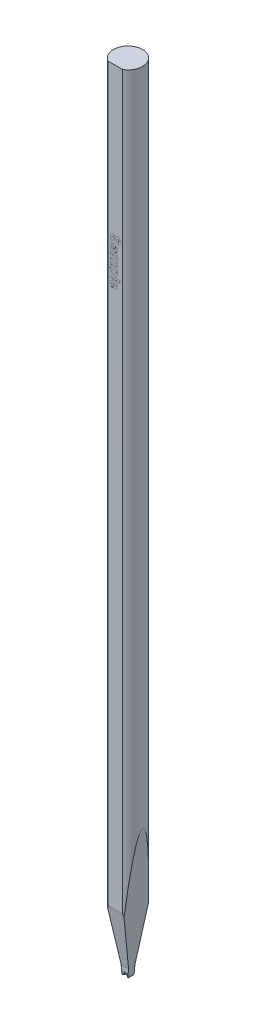
from build123d import *

# Parameters (mm, degrees)
SKETCH_TL_CUTTING_R       = 1.4986
TL_CUTTING_DEPTH          = 81.28
SKETCH_TDF_GRINDING_W     = 3.0172
SKETCH_TDF_GRINDING_H     = 3.0172
TDF_GRINDING_DEPTH        = 82.307625743
SKETCH_ENGRAVING_W        = 1
SKETCH_ENGRAVING_H        = 0.192307692
ENGRAVING_DEPTH           = 0.005
VW_VR_GRINDING_DEPTH      = 1.5086
VW_VR_GRINDING_DEPTH_BACK = 1.5086
ISA_GRINDING_DEPTH        = 1.5086
ISA_GRINDING_DEPTH_BACK   = 1.5086
PRE_FRX_BRX_DEPTH         = 1.5086
PRE_FRX_BRX_DEPTH_BACK    = 1.5086
SKETCH_PRE_FRX_BRX_W      = 1.18348
SKETCH_PRE_FRX_BRX_H      = 0.889
FR_EDM_R                  = 0.22606
BR_EDM_R                  = 0.22606
FA_BA_GRINDING_DEPTH      = 1.5086
FA_BA_GRINDING_DEPTH_BACK = 1.5086


with BuildPart() as part:
    # sketch_TL_cutting → TL_cutting (new body)
    with BuildSketch(Plane(origin=(0, 0, 0), x_dir=(1, 0, 0), z_dir=(0, 1, 0))):
        Circle(SKETCH_TL_CUTTING_R)
    extrude(amount=TL_CUTTING_DEPTH)

    # sketch_TDF_grinding → TDF_grinding (cut, through all)
    with BuildSketch(Plane(origin=(0, 0, 0), x_dir=(1, 0, 0), z_dir=(0, 1, 0))):
        with Locations((0, -2.804)):
            Rectangle(SKETCH_TDF_GRINDING_W, SKETCH_TDF_GRINDING_H)
    extrude(amount=TDF_GRINDING_DEPTH, mode=Mode.SUBTRACT)

    # sketch_engraving → engraving (cut)
    # profile 1 of 6: a face of its own
    with BuildSketch(Plane.XY.offset(1.2954)):
        with BuildLine():
            Line((-0.166666667, 66.228717949), (-0.153846154, 66.036410256))
            add(Edge.make_bspline(
                [(-0.153846154, 66.036410256), (-0.161891279, 66.034877607), (-0.177518424, 66.031900534), (-0.199795017, 66.025296625), (-0.220541784, 66.017990456), (-0.239662803, 66.009377579), (-0.25710555, 65.999512511), (-0.273156714, 65.988722233), (-0.28732832, 65.976479477), (-0.299925293, 65.963147792), (-0.310783278, 65.948574614), (-0.320246275, 65.932874014), (-0.328256178, 65.915952746), (-0.334922245, 65.897875434), (-0.339885492, 65.878462022), (-0.343420115, 65.857894378), (-0.345682646, 65.836139377), (-0.345994208, 65.821271711), (-0.346153846, 65.813653846)],
                knots=[0, 0, 0, 0, 1.20477517, 2.340199137, 3.415898527, 4.440826703, 5.422227366, 6.362763262, 7.28278988, 8.172822029, 9.057410505, 9.952475558, 10.866920142, 11.809098, 12.784128911, 13.811833846, 14.878831738, 16, 16, 16, 16], degree=3))
            add(Edge.make_bspline(
                [(-0.346153846, 65.813653846), (-0.346066367, 65.805635548), (-0.345896216, 65.790039545), (-0.343785338, 65.767439212), (-0.340761278, 65.746306874), (-0.335974263, 65.726829137), (-0.330620744, 65.708642273), (-0.323296559, 65.692197968), (-0.314849171, 65.677230114), (-0.305263574, 65.663777272), (-0.294632459, 65.652036964), (-0.28353392, 65.641765956), (-0.272207737, 65.632820587), (-0.260151301, 65.625779949), (-0.247852227, 65.620082055), (-0.234943611, 65.616316145), (-0.221721863, 65.613772051), (-0.212685699, 65.613480317), (-0.208133013, 65.613333333)],
                knots=[0, 0, 0, 0, 1.417779877, 2.757654889, 4.012140507, 5.189587551, 6.302846416, 7.360586765, 8.365575446, 9.33904572, 10.275781718, 11.161696098, 12.012180333, 12.822428111, 13.625933072, 14.403138519, 15.195454004, 16, 16, 16, 16], degree=3))
            add(Edge.make_bspline(
                [(-0.208133013, 65.613333333), (-0.202439146, 65.613627611), (-0.191320796, 65.614202244), (-0.175220679, 65.617972543), (-0.160658688, 65.624777047), (-0.147071392, 65.634013587), (-0.134926522, 65.646977985), (-0.123459543, 65.663382139), (-0.11316916, 65.683841853), (-0.107424402, 65.699010458), (-0.104366987, 65.707083333)],
                knots=[0, 0, 0, 0, 0.906150226, 1.7694295, 2.610923838, 3.450874087, 4.367551936, 5.419872502, 6.626831617, 8, 8, 8, 8], degree=3))
            add(Edge.make_bspline(
                [(-0.104366987, 65.707083333), (-0.103205903, 65.710547521), (-0.100607587, 65.718299809), (-0.096897182, 65.731525769), (-0.092218385, 65.747511172), (-0.087052561, 65.766404594), (-0.081545375, 65.7881675), (-0.074955523, 65.812593148), (-0.068334023, 65.840052448), (-0.063456004, 65.85926551), (-0.060897436, 65.869342949)],
                knots=[0, 0, 0, 0, 0.521824192, 1.167757792, 1.961731518, 2.901193269, 3.965386864, 5.168422915, 6.514810244, 8, 8, 8, 8], degree=3))
            add(Edge.make_bspline(
                [(-0.060897436, 65.869342949), (-0.0576208, 65.882466465), (-0.051299067, 65.907786143), (-0.040053153, 65.943897802), (-0.028879714, 65.9771573), (-0.016755933, 66.007244403), (-0.004503472, 66.034490983), (0.008737874, 66.058456319), (0.022280434, 66.079640515), (0.032402475, 66.091985038), (0.037259615, 66.097908654)],
                knots=[0, 0, 0, 0, 1.293880989, 2.496331788, 3.617634808, 4.64976062, 5.598842568, 6.473791081, 7.267636666, 8, 8, 8, 8], degree=3))
            add(Edge.make_bspline(
                [(0.037259615, 66.097908654), (0.044137694, 66.105254708), (0.057622804, 66.119657326), (0.079781426, 66.138616137), (0.103188466, 66.154546701), (0.127671148, 66.1676593), (0.153370416, 66.177755752), (0.180114252, 66.184911988), (0.207972454, 66.189543764), (0.22694455, 66.190016405), (0.236578526, 66.19025641)],
                knots=[0, 0, 0, 0, 1.064429417, 2.086912298, 3.078678339, 4.055528992, 5.020032834, 5.993708893, 6.981211098, 8, 8, 8, 8], degree=3))
            add(Edge.make_bspline(
                [(0.236578526, 66.19025641), (0.249044725, 66.189788947), (0.273773943, 66.188861639), (0.310123415, 66.180359285), (0.34519423, 66.167110895), (0.373053378, 66.151758506), (0.394102454, 66.136979981), (0.409316468, 66.124753329), (0.423234984, 66.111063515), (0.436363342, 66.096402084), (0.448421192, 66.080522948), (0.459337354, 66.063406575), (0.469762031, 66.04537482), (0.481724432, 66.019062443), (0.494501972, 65.983531575), (0.505216674, 65.937296526), (0.511620444, 65.886950752), (0.512410831, 65.852001491), (0.512820513, 65.833886218)],
                knots=[0, 0, 0, 0, 1.180224575, 2.341213254, 3.519178081, 4.726056898, 5.344182394, 5.956118988, 6.573855441, 7.192564044, 7.82049682, 8.461345463, 9.116141012, 9.79299132, 11.198532007, 12.687823846, 14.283197644, 16, 16, 16, 16], degree=3))
            add(Edge.make_bspline(
                [(0.512820513, 65.833886218), (0.512622915, 65.819053184), (0.512238592, 65.79020325), (0.508327094, 65.748385277), (0.502300976, 65.709376936), (0.493471523, 65.67324209), (0.482080613, 65.639912702), (0.468307987, 65.609323819), (0.4520288, 65.58155582), (0.433078398, 65.556903847), (0.412189308, 65.534940609), (0.389371716, 65.515781372), (0.364914548, 65.49935264), (0.338835479, 65.485548448), (0.311000478, 65.47470805), (0.281444264, 65.466746206), (0.250236407, 65.461480173), (0.228852471, 65.460160226), (0.217948718, 65.459487179)],
                knots=[0, 0, 0, 0, 1.325136797, 2.577362738, 3.74962816, 4.849499017, 5.896771726, 6.892816139, 7.842473141, 8.766187929, 9.665133525, 10.546015357, 11.42313021, 12.293255665, 13.177485873, 14.086514152, 15.024305989, 16, 16, 16, 16], degree=3))
            Line((0.217948718, 65.459487179), (0.205128205, 65.651794872))
            add(Edge.make_bspline(
                [(0.205128205, 65.651794872), (0.211158714, 65.652903797), (0.22291155, 65.655064976), (0.239739753, 65.659772083), (0.255319488, 65.66505285), (0.269550394, 65.67131916), (0.282452554, 65.678537492), (0.29405422, 65.686741672), (0.304442868, 65.695777543), (0.313348905, 65.706026012), (0.321255295, 65.717250185), (0.327770309, 65.729876673), (0.333732615, 65.7435148), (0.338229411, 65.758675772), (0.341791978, 65.775084625), (0.344434282, 65.792746154), (0.34572413, 65.811698367), (0.346007328, 65.824736733), (0.346153846, 65.831482372)],
                knots=[0, 0, 0, 0, 1.150775252, 2.242741279, 3.277646382, 4.23752694, 5.158201782, 6.048759188, 6.901533576, 7.736611693, 8.592238639, 9.472855288, 10.399741491, 11.383322377, 12.435924598, 13.551250831, 14.733094547, 16, 16, 16, 16], degree=3))
            add(Edge.make_bspline(
                [(0.346153846, 65.831482372), (0.346024502, 65.838495999), (0.345772856, 65.852141324), (0.344228543, 65.8720262), (0.34137789, 65.890679706), (0.337667048, 65.908193454), (0.332618703, 65.924544049), (0.326463073, 65.939696989), (0.319216002, 65.953721597), (0.313514257, 65.962273191), (0.310697115, 65.966498397)],
                knots=[0, 0, 0, 0, 1.186678824, 2.308736671, 3.37120409, 4.377216403, 5.334874112, 6.262130804, 7.141346615, 8, 8, 8, 8], degree=3))
            add(Edge.make_bspline(
                [(0.310697115, 65.966498397), (0.30684882, 65.971333791), (0.299395868, 65.980698448), (0.284596838, 65.9907768), (0.267881777, 65.996843991), (0.256061421, 65.997574247), (0.25, 65.997948718)],
                knots=[0, 0, 0, 0, 1.037857257, 2.010007357, 2.979541333, 4, 4, 4, 4], degree=3))
            add(Edge.make_bspline(
                [(0.25, 65.997948718), (0.244335199, 65.997642469), (0.233176443, 65.997039206), (0.217325189, 65.990954527), (0.202637862, 65.98159712), (0.194659513, 65.972854158), (0.190504808, 65.968301282)],
                knots=[0, 0, 0, 0, 0.98538058, 1.941042925, 2.927803204, 4, 4, 4, 4], degree=3))
            add(Edge.make_bspline(
                [(0.190504808, 65.968301282), (0.187808196, 65.964687988), (0.18178239, 65.956613781), (0.17412302, 65.941823434), (0.165827461, 65.923971096), (0.157717635, 65.902649778), (0.149622864, 65.878001181), (0.141170987, 65.850023806), (0.132605635, 65.818700446), (0.124310512, 65.784829517), (0.116156882, 65.750440984), (0.107242663, 65.717624955), (0.098551989, 65.687110767), (0.089442753, 65.659039906), (0.080574939, 65.633267671), (0.071467056, 65.609919256), (0.062596997, 65.58883434), (0.050400038, 65.564246991), (0.033878763, 65.536379703), (0.009862335, 65.507171642), (-0.017133698, 65.48134084), (-0.042589095, 65.463342623), (-0.064481415, 65.450978789), (-0.081932142, 65.443017785), (-0.100320809, 65.436130892), (-0.119667735, 65.43052498), (-0.140000145, 65.426462043), (-0.161162698, 65.423099726), (-0.183331155, 65.421381856), (-0.198448465, 65.421145657), (-0.206129808, 65.421025641)],
                knots=[0, 0, 0, 0, 0.511875881, 1.143829537, 1.88775736, 2.750598373, 3.734912702, 4.837306479, 6.073130119, 7.42648979, 8.801963576, 10.091065733, 11.292408984, 12.408830014, 13.446061236, 14.39066453, 15.257936293, 16.045629259, 17.510392066, 18.929669597, 20.331293837, 21.746891395, 22.460690638, 23.187651344, 23.925159671, 24.69163991, 25.474819891, 26.281170188, 27.126635539, 28, 28, 28, 28], degree=3))
            add(Edge.make_bspline(
                [(-0.206129808, 65.421025641), (-0.213213723, 65.421190667), (-0.227281693, 65.421518393), (-0.248162112, 65.42380863), (-0.268671734, 65.427350423), (-0.288836268, 65.432593495), (-0.308616053, 65.439548961), (-0.328296541, 65.447380279), (-0.347448635, 65.45717284), (-0.366087841, 65.468318337), (-0.384201522, 65.48061148), (-0.400907086, 65.494545053), (-0.416780552, 65.509286381), (-0.430830184, 65.525791492), (-0.444499814, 65.542874729), (-0.456413626, 65.561651015), (-0.467267368, 65.581519569), (-0.476944445, 65.602661493), (-0.485241283, 65.625146826), (-0.492760445, 65.648840495), (-0.498861937, 65.67396603), (-0.504102567, 65.700352968), (-0.508085093, 65.728103742), (-0.510866581, 65.757181988), (-0.512434986, 65.787594789), (-0.512690407, 65.80831022), (-0.512820513, 65.818862179)],
                knots=[0, 0, 0, 0, 0.900523777, 1.788352984, 2.667658312, 3.544829998, 4.433470602, 5.332071549, 6.235671317, 7.16456001, 8.092361829, 9.015217829, 9.927983376, 10.842405559, 11.767913001, 12.707486241, 13.664840466, 14.644960138, 15.660436429, 16.710285012, 17.80361473, 18.945755434, 20.129541241, 21.366238063, 22.658422763, 24, 24, 24, 24], degree=3))
            add(Edge.make_bspline(
                [(-0.512820513, 65.818862179), (-0.512571769, 65.834097584), (-0.512087459, 65.863761277), (-0.507752501, 65.906857296), (-0.501117535, 65.947278506), (-0.491487967, 65.98495912), (-0.47912575, 66.019945132), (-0.463898318, 66.052220803), (-0.445714308, 66.081629249), (-0.4250161, 66.108537493), (-0.401421388, 66.132576838), (-0.37543806, 66.154222472), (-0.346733609, 66.173055309), (-0.315676999, 66.189585327), (-0.28185988, 66.203074186), (-0.245840091, 66.214602175), (-0.207125792, 66.223178959), (-0.180386288, 66.226839687), (-0.166666667, 66.228717949)],
                knots=[0, 0, 0, 0, 1.217919187, 2.371317543, 3.459749122, 4.490553404, 5.476795534, 6.422548752, 7.338285933, 8.236452553, 9.131296239, 10.026155855, 10.935394819, 11.871650654, 12.834387429, 13.842485342, 14.893012909, 16, 16, 16, 16], degree=3))
        make_face()
    # profile 2 of 6: a face of its own
    with BuildSketch(Plane.XY.offset(1.2954)):
        with BuildLine():
            Line((0.012820513, 65.126153846), (0.038461538, 65.292820513))
            add(Edge.make_bspline(
                [(0.038461538, 65.292820513), (0.046909054, 65.290322773), (0.063444893, 65.285433497), (0.0871409, 65.276461597), (0.109047839, 65.265955594), (0.129427422, 65.254368962), (0.148056862, 65.241344679), (0.164984622, 65.227090911), (0.180152765, 65.211527103), (0.19367872, 65.194578871), (0.205694353, 65.17592015), (0.215881219, 65.155127383), (0.224458705, 65.132231732), (0.231351998, 65.107265345), (0.237115058, 65.080270108), (0.240643117, 65.051039394), (0.243189827, 65.019761739), (0.243453822, 64.99822163), (0.243589744, 64.98713141)],
                knots=[0, 0, 0, 0, 1.047140172, 2.049755565, 3.008539736, 3.933190086, 4.833981818, 5.707167246, 6.560530269, 7.413560864, 8.281243119, 9.193714071, 10.161006392, 11.183910126, 12.270717139, 13.439589873, 14.681737877, 16, 16, 16, 16], degree=3))
            add(Edge.make_bspline(
                [(0.243589744, 64.98713141), (0.243534228, 64.977046723), (0.243426815, 64.957534437), (0.242000124, 64.92926808), (0.239698922, 64.903054289), (0.236188636, 64.878814358), (0.232169239, 64.856495802), (0.226945807, 64.836146141), (0.220823169, 64.817813075), (0.211299506, 64.796630462), (0.197913915, 64.773367886), (0.179756247, 64.74906565), (0.159013578, 64.729617094), (0.139821698, 64.716528755), (0.122335675, 64.708827836), (0.106814059, 64.703855466), (0.088956248, 64.699474221), (0.068502887, 64.69624198), (0.045803313, 64.693340808), (0.020516352, 64.691733811), (-0.007131366, 64.690443155), (-0.026440401, 64.690320201), (-0.036458333, 64.69025641)],
                knots=[0, 0, 0, 0, 1.253089278, 2.424530831, 3.516103812, 4.521791402, 5.467348922, 6.332758186, 7.130477226, 7.865998692, 9.215316109, 10.458392318, 11.620687606, 12.7345829, 13.32519123, 13.989073223, 14.757870489, 15.607744835, 16.560809343, 17.600728964, 18.755207866, 20, 20, 20, 20], degree=3))
            Line((-0.036458333, 64.69025641), (-0.261017628, 64.69025641))
            add(Edge.make_bspline(
                [(-0.261017628, 64.69025641), (-0.26876291, 64.690191106), (-0.283720285, 64.690064994), (-0.305369916, 64.689858726), (-0.325384127, 64.68860567), (-0.343848542, 64.687883727), (-0.360723997, 64.686104895), (-0.3760468, 64.684451041), (-0.389817284, 64.68223103), (-0.406271816, 64.678727434), (-0.426174196, 64.672982854), (-0.450246687, 64.664096636), (-0.475006195, 64.652613939), (-0.491503263, 64.643611185), (-0.5, 64.638974359)],
                knots=[0, 0, 0, 0, 1.124133555, 2.170881208, 3.141136401, 4.03397314, 4.851653906, 5.602897914, 6.270414243, 6.874806075, 8.043499627, 9.272964875, 10.595453442, 12, 12, 12, 12], degree=3))
            Line((-0.5, 64.638974359), (-0.5, 64.831282051))
            add(Edge.make_bspline(
                [(-0.5, 64.831282051), (-0.496139139, 64.832654663), (-0.487679201, 64.835662336), (-0.473498086, 64.839724209), (-0.456975369, 64.844592099), (-0.445053008, 64.847801538), (-0.438701923, 64.849511218)],
                knots=[0, 0, 0, 0, 0.768508203, 1.683958961, 2.766236402, 4, 4, 4, 4], degree=3))
            add(Edge.make_bspline(
                [(-0.438701923, 64.849511218), (-0.435886901, 64.850208108), (-0.430774033, 64.851473855), (-0.423993811, 64.853691297), (-0.418613075, 64.854860943), (-0.415659063, 64.855901037), (-0.414463141, 64.856322115)],
                knots=[0, 0, 0, 0, 1.38134116, 2.508902287, 3.396334264, 4, 4, 4, 4], degree=3))
            add(Edge.make_bspline(
                [(-0.414463141, 64.856322115), (-0.422306637, 64.864457559), (-0.437655041, 64.880377254), (-0.457532204, 64.906341122), (-0.474646093, 64.932866544), (-0.488605327, 64.960386904), (-0.499566193, 64.988746676), (-0.507080988, 65.018140575), (-0.511891829, 65.048405165), (-0.512508639, 65.068910725), (-0.512820513, 65.079278846)],
                knots=[0, 0, 0, 0, 1.082278699, 2.117837564, 3.127951196, 4.103896207, 5.070141411, 6.035602179, 7.006751569, 8, 8, 8, 8], degree=3))
            add(Edge.make_bspline(
                [(-0.512820513, 65.079278846), (-0.512611735, 65.08829889), (-0.51220396, 65.105916381), (-0.50951013, 65.131624012), (-0.504401451, 65.155789166), (-0.497605711, 65.178521026), (-0.489067093, 65.199880039), (-0.478321262, 65.219662593), (-0.465716244, 65.23801315), (-0.450989615, 65.25454154), (-0.435073542, 65.269551608), (-0.417958735, 65.282644355), (-0.399800554, 65.293800397), (-0.380541476, 65.302748564), (-0.360298141, 65.309888733), (-0.339064305, 65.314796291), (-0.316799924, 65.317929124), (-0.301626775, 65.318281435), (-0.293870192, 65.318461538)],
                knots=[0, 0, 0, 0, 1.18658458, 2.31757657, 3.394226474, 4.430715881, 5.435456892, 6.414057866, 7.386212409, 8.35709637, 9.320281587, 10.260156395, 11.186596348, 12.117853754, 13.048448167, 14.005042754, 14.980168739, 16, 16, 16, 16], degree=3))
            add(Edge.make_bspline(
                [(-0.293870192, 65.318461538), (-0.283700577, 65.31810511), (-0.263757923, 65.317406153), (-0.234652538, 65.312208551), (-0.207362153, 65.303020466), (-0.181862262, 65.290629198), (-0.158596875, 65.27506418), (-0.138063167, 65.256372743), (-0.120502285, 65.234769213), (-0.105770222, 65.2096943), (-0.093232389, 65.180477431), (-0.081107706, 65.146412551), (-0.070353555, 65.106569614), (-0.064168165, 65.077973636), (-0.060897436, 65.062852564)],
                knots=[0, 0, 0, 0, 0.956565251, 1.875828012, 2.769799286, 3.657635185, 4.535794535, 5.394066738, 6.260416921, 7.14495727, 8.120882861, 9.247498621, 10.544523601, 12, 12, 12, 12], degree=3))
            add(Edge.make_bspline(
                [(-0.060897436, 65.062852564), (-0.058777918, 65.052432311), (-0.054697922, 65.032373691), (-0.048550502, 65.003563846), (-0.042415315, 64.977294761), (-0.036019644, 64.953603672), (-0.030418943, 64.932204546), (-0.024623629, 64.913353208), (-0.018838679, 64.897055523), (-0.014727786, 64.887156714), (-0.012820513, 64.882564103)],
                knots=[0, 0, 0, 0, 1.365617471, 2.628765604, 3.783168753, 4.829402825, 5.780074121, 6.623651276, 7.361434847, 8, 8, 8, 8], degree=3))
            Line((-0.012820513, 64.882564103), (0.005408654, 64.882564103))
            add(Edge.make_bspline(
                [(0.005408654, 64.882564103), (0.013579622, 64.88282195), (0.028753575, 64.883300787), (0.049815104, 64.888012783), (0.067054204, 64.896267499), (0.078735074, 64.905966174), (0.085649046, 64.915766975), (0.090345699, 64.924467914), (0.093950934, 64.934721013), (0.097287101, 64.946260364), (0.0995171, 64.959301833), (0.101382359, 64.973729797), (0.102294697, 64.98959078), (0.102471846, 65.000618931), (0.102564103, 65.006362179)],
                knots=[0, 0, 0, 0, 1.600017626, 2.971323677, 4.194571328, 5.31736933, 5.898517236, 6.536691297, 7.248930295, 8.023708211, 8.888724419, 9.83830628, 10.874231527, 12, 12, 12, 12], degree=3))
            add(Edge.make_bspline(
                [(0.102564103, 65.006362179), (0.102372886, 65.013991824), (0.102007879, 65.02855582), (0.098228604, 65.049020653), (0.092028517, 65.066964405), (0.083011553, 65.082505158), (0.070677976, 65.095940445), (0.054784235, 65.107641921), (0.03524962, 65.118007335), (0.020578142, 65.123336186), (0.012820513, 65.126153846)],
                knots=[0, 0, 0, 0, 1.120624541, 2.139125895, 3.045753857, 3.899333821, 4.761059621, 5.707367731, 6.787757473, 8, 8, 8, 8], degree=3))
        make_face()
        with BuildLine():
            add(Edge.make_bspline(
                [(-0.153846154, 64.882564103), (-0.155885143, 64.889164138), (-0.16047749, 64.904029178), (-0.167188394, 64.928940204), (-0.174366647, 64.958953522), (-0.180456821, 64.986656294), (-0.185514697, 65.009876191), (-0.189475935, 65.026252939), (-0.193539681, 65.040999709), (-0.197441348, 65.054126554), (-0.201486639, 65.065681533), (-0.205463261, 65.075551125), (-0.209129994, 65.08400598), (-0.212150439, 65.088724204), (-0.213541667, 65.090897436)],
                knots=[0, 0, 0, 0, 1.144251806, 2.577159925, 4.272729571, 6.25595871, 7.275767821, 8.209390473, 9.046628288, 9.809462825, 10.477647263, 11.07332096, 11.573168194, 12, 12, 12, 12], degree=3))
            add(Edge.make_bspline(
                [(-0.213541667, 65.090897436), (-0.217777869, 65.096276024), (-0.225907663, 65.106598198), (-0.241618317, 65.117850564), (-0.259035906, 65.124990897), (-0.271365501, 65.12576145), (-0.277644231, 65.126153846)],
                knots=[0, 0, 0, 0, 1.075028234, 2.063111864, 3.013658082, 4, 4, 4, 4], degree=3))
            add(Edge.make_bspline(
                [(-0.277644231, 65.126153846), (-0.283891387, 65.12580773), (-0.296145658, 65.125128798), (-0.31380435, 65.1197217), (-0.329979349, 65.110627478), (-0.344370894, 65.098247385), (-0.356745621, 65.083373769), (-0.365439774, 65.065879161), (-0.370822638, 65.046475583), (-0.371463572, 65.032840996), (-0.371794872, 65.025793269)],
                knots=[0, 0, 0, 0, 0.97671936, 1.915908908, 2.861187175, 3.862381481, 4.872972798, 5.868749731, 6.898355403, 8, 8, 8, 8], degree=3))
            add(Edge.make_bspline(
                [(-0.371794872, 65.025793269), (-0.37143029, 65.017735914), (-0.370696317, 65.001514937), (-0.363990016, 64.977724736), (-0.354091612, 64.954236416), (-0.344349902, 64.939974458), (-0.339342949, 64.932644231)],
                knots=[0, 0, 0, 0, 0.962503947, 1.937702252, 2.940039444, 4, 4, 4, 4], degree=3))
            add(Edge.make_bspline(
                [(-0.339342949, 64.932644231), (-0.335175233, 64.927467353), (-0.32707178, 64.917401747), (-0.312263496, 64.905404959), (-0.296511013, 64.89550495), (-0.284890152, 64.891559389), (-0.279046474, 64.889575321)],
                knots=[0, 0, 0, 0, 1.055399509, 2.052054707, 3.020454315, 4, 4, 4, 4], degree=3))
            add(Edge.make_bspline(
                [(-0.279046474, 64.889575321), (-0.274254264, 64.888481826), (-0.263036327, 64.885922099), (-0.243287652, 64.884116149), (-0.218440013, 64.88265525), (-0.200124236, 64.882596334), (-0.190104167, 64.882564103)],
                knots=[0, 0, 0, 0, 0.659054705, 1.542760655, 2.655710416, 4, 4, 4, 4], degree=3))
            Line((-0.190104167, 64.882564103), (-0.153846154, 64.882564103))
        make_face(mode=Mode.SUBTRACT)
    # profile 3 of 6: a face of its own
    with BuildSketch(Plane.XY.offset(1.2954)):
        with BuildLine():
            Line((0.230769231, 64.510769231), (0.230769231, 64.318461538))
            Line((0.230769231, 64.318461538), (0.1328125, 64.318461538))
            add(Edge.make_bspline(
                [(0.1328125, 64.318461538), (0.141664699, 64.310897511), (0.158931351, 64.296143499), (0.181382685, 64.271462251), (0.200586186, 64.2459552), (0.21644089, 64.21937127), (0.228531159, 64.191472579), (0.237134296, 64.162485336), (0.242539521, 64.13243041), (0.243237377, 64.112020357), (0.243589744, 64.101714744)],
                knots=[0, 0, 0, 0, 1.107940857, 2.161093632, 3.169644562, 4.144639019, 5.101548547, 6.057210626, 7.019030711, 8, 8, 8, 8], degree=3))
            add(Edge.make_bspline(
                [(0.243589744, 64.101714744), (0.243215794, 64.090948495), (0.242486901, 64.069963206), (0.237632212, 64.039505651), (0.228624904, 64.01142895), (0.216596826, 63.985473491), (0.200997643, 63.961725385), (0.181697421, 63.940341944), (0.1589088, 63.921109403), (0.141647297, 63.910586276), (0.1328125, 63.905200321)],
                knots=[0, 0, 0, 0, 1.087442074, 2.119613481, 3.102840357, 4.056171906, 5.000733146, 5.960649063, 6.95621775, 8, 8, 8, 8], degree=3))
            add(Edge.make_bspline(
                [(0.1328125, 63.905200321), (0.141648331, 63.897280271), (0.15890459, 63.881812522), (0.18160607, 63.856450997), (0.200837622, 63.830127047), (0.216342266, 63.802724069), (0.228440547, 63.774425033), (0.237463475, 63.745274977), (0.242455792, 63.714933774), (0.243209151, 63.694413285), (0.243589744, 63.684046474)],
                knots=[0, 0, 0, 0, 1.113355786, 2.174368662, 3.188819075, 4.168565139, 5.12342631, 6.073356391, 7.026672896, 8, 8, 8, 8], degree=3))
            add(Edge.make_bspline(
                [(0.243589744, 63.684046474), (0.243253707, 63.671264411), (0.242603687, 63.64653916), (0.236233833, 63.610990396), (0.226092646, 63.578384669), (0.211825029, 63.548909889), (0.193628332, 63.522613111), (0.171312748, 63.500075383), (0.145297956, 63.480737741), (0.125650654, 63.471322182), (0.115584936, 63.466498397)],
                knots=[0, 0, 0, 0, 1.140905914, 2.206935121, 3.214358517, 4.182792527, 5.121068659, 6.057503675, 7.004819049, 8, 8, 8, 8], degree=3))
            add(Edge.make_bspline(
                [(0.115584936, 63.466498397), (0.1114006, 63.464896604), (0.102614163, 63.461533095), (0.088193677, 63.457579062), (0.07205936, 63.454256297), (0.05407705, 63.451438692), (0.034354022, 63.449322459), (0.012779717, 63.447648455), (-0.010546601, 63.44699832), (-0.026709385, 63.446779611), (-0.03505609, 63.446666667)],
                knots=[0, 0, 0, 0, 0.70348757, 1.477211565, 2.345356006, 3.290383569, 4.335215205, 5.460703428, 6.68866909, 8, 8, 8, 8], degree=3))
            Line((-0.03505609, 63.446666667), (-0.5, 63.446666667))
            Line((-0.5, 63.446666667), (-0.5, 63.638974359))
            Line((-0.5, 63.638974359), (-0.080128205, 63.638974359))
            add(Edge.make_bspline(
                [(-0.080128205, 63.638974359), (-0.07144761, 63.639086396), (-0.054817384, 63.639301037), (-0.031090468, 63.639945192), (-0.009777274, 63.641583104), (0.009076857, 63.643724828), (0.025551617, 63.646457511), (0.039613136, 63.649833558), (0.051411557, 63.653627728), (0.058064109, 63.657184264), (0.061097756, 63.65880609)],
                knots=[0, 0, 0, 0, 1.448583407, 2.775186282, 3.959557885, 5.014017743, 5.940851432, 6.743435621, 7.42699079, 8, 8, 8, 8], degree=3))
            add(Edge.make_bspline(
                [(0.061097756, 63.65880609), (0.0644449, 63.661046703), (0.071015994, 63.665445463), (0.079428524, 63.673581971), (0.086594396, 63.682526034), (0.092366124, 63.692410543), (0.097066603, 63.703069139), (0.100204228, 63.714687303), (0.10230955, 63.727171978), (0.102477414, 63.735853298), (0.102564103, 63.740336538)],
                knots=[0, 0, 0, 0, 1.007330723, 1.977586358, 2.91811154, 3.870610884, 4.837109745, 5.827490497, 6.87806446, 8, 8, 8, 8], degree=3))
            add(Edge.make_bspline(
                [(0.102564103, 63.740336538), (0.102240034, 63.746972111), (0.101593875, 63.760202775), (0.09685111, 63.779660701), (0.088810593, 63.798387428), (0.077873982, 63.816238407), (0.064089543, 63.832877276), (0.046951113, 63.846953185), (0.027058253, 63.858722569), (0.008201325, 63.866104518), (-0.008714124, 63.87081352), (-0.023370098, 63.873967347), (-0.039736185, 63.876768488), (-0.057919723, 63.878964673), (-0.07777632, 63.880456881), (-0.09941442, 63.881666157), (-0.122723067, 63.882512129), (-0.138888099, 63.882546404), (-0.147235577, 63.882564103)],
                knots=[0, 0, 0, 0, 0.980909897, 1.955835539, 2.942693402, 3.98436442, 5.042755257, 6.12263035, 7.247279534, 8.448501813, 9.105087946, 9.843148781, 10.66469806, 11.560151265, 12.550905382, 13.609296218, 14.765461946, 16, 16, 16, 16], degree=3))
            Line((-0.147235577, 63.882564103), (-0.5, 63.882564103))
            Line((-0.5, 63.882564103), (-0.5, 64.074871795))
            Line((-0.5, 64.074871795), (-0.097355769, 64.074871795))
            add(Edge.make_bspline(
                [(-0.097355769, 64.074871795), (-0.088808683, 64.074926135), (-0.072514885, 64.075029726), (-0.049272866, 64.075370876), (-0.028431625, 64.076137425), (-0.010001412, 64.077354799), (0.006094573, 64.078757797), (0.019817647, 64.080232173), (0.031211059, 64.082185261), (0.042972639, 64.085301362), (0.055281064, 64.090213036), (0.068015353, 64.097443829), (0.078952496, 64.105913541), (0.087734398, 64.116130961), (0.094431133, 64.128066292), (0.099289836, 64.141728729), (0.101996826, 64.157298124), (0.102369061, 64.168277531), (0.102564103, 64.174030449)],
                knots=[0, 0, 0, 0, 1.59941463, 3.049055322, 4.349500855, 5.501487129, 6.504910079, 7.372843676, 8.083634967, 8.665560774, 9.647038445, 10.55368294, 11.398647399, 12.222657519, 13.056461931, 13.945719492, 14.92361148, 16, 16, 16, 16], degree=3))
            add(Edge.make_bspline(
                [(0.102564103, 64.174030449), (0.102234348, 64.181196829), (0.101586917, 64.195267082), (0.097099356, 64.215860655), (0.089385598, 64.235235661), (0.078745529, 64.253299036), (0.065308531, 64.269702826), (0.048811546, 64.28360159), (0.02977557, 64.295138856), (0.011740073, 64.30242889), (-0.004479026, 64.307158642), (-0.018770373, 64.310049471), (-0.034874654, 64.312649694), (-0.052844538, 64.314858981), (-0.072766981, 64.316377908), (-0.094540599, 64.31755338), (-0.118182385, 64.31841378), (-0.134547779, 64.318445237), (-0.143028846, 64.318461538)],
                knots=[0, 0, 0, 0, 1.061105177, 2.08334182, 3.104381884, 4.137278018, 5.176827868, 6.229094397, 7.316239487, 8.460364206, 9.09881589, 9.816452537, 10.617971519, 11.514628853, 12.496857794, 13.576419947, 14.74402393, 16, 16, 16, 16], degree=3))
            Line((-0.143028846, 64.318461538), (-0.5, 64.318461538))
            Line((-0.5, 64.318461538), (-0.5, 64.510769231))
            Line((-0.5, 64.510769231), (0.230769231, 64.510769231))
        make_face()
    # profile 4 of 6: a face of its own
    with BuildSketch(Plane.XY.offset(1.2954)):
        with BuildLine():
            Line((0.230769231, 63.254358974), (0.230769231, 63.062051282))
            Line((0.230769231, 63.062051282), (0.125400641, 63.062051282))
            add(Edge.make_bspline(
                [(0.125400641, 63.062051282), (0.134110558, 63.056328192), (0.151482958, 63.04491318), (0.174623276, 63.02385835), (0.194727471, 62.999718206), (0.21216262, 62.973179417), (0.226252501, 62.944345376), (0.236247247, 62.913671975), (0.242498657, 62.881481858), (0.243222023, 62.859489189), (0.243589744, 62.848309295)],
                knots=[0, 0, 0, 0, 0.978547196, 1.95176541, 2.927409496, 3.924956672, 4.929940552, 5.934297003, 6.949907262, 8, 8, 8, 8], degree=3))
            add(Edge.make_bspline(
                [(0.243589744, 62.848309295), (0.243275199, 62.838541821), (0.242653327, 62.819231017), (0.237904657, 62.790874643), (0.230300531, 62.763557527), (0.219424348, 62.737376502), (0.205256392, 62.712439427), (0.188112758, 62.688677123), (0.167850875, 62.666116128), (0.144791975, 62.644820256), (0.118886648, 62.625323008), (0.090438984, 62.608285417), (0.059420431, 62.594050634), (0.02614289, 62.582152555), (-0.00973483, 62.573328479), (-0.047865347, 62.566627494), (-0.088468702, 62.562921584), (-0.116312431, 62.562346541), (-0.130608974, 62.562051282)],
                knots=[0, 0, 0, 0, 0.889183518, 1.757962001, 2.610823862, 3.466866804, 4.332788647, 5.217155532, 6.130223362, 7.089913047, 8.071415563, 9.077827182, 10.103546864, 11.174887114, 12.291391641, 13.464112916, 14.69793237, 16, 16, 16, 16], degree=3))
            add(Edge.make_bspline(
                [(-0.130608974, 62.562051282), (-0.145309675, 62.562315908), (-0.173899782, 62.562830556), (-0.215458383, 62.566940588), (-0.254585771, 62.573314968), (-0.291083626, 62.583120651), (-0.325347568, 62.594933416), (-0.356921697, 62.609865855), (-0.386073852, 62.627339567), (-0.412336985, 62.6475977), (-0.435948519, 62.669531194), (-0.456547424, 62.692845565), (-0.473866574, 62.71737144), (-0.488041441, 62.743039276), (-0.499108447, 62.769855372), (-0.507216556, 62.797768366), (-0.511869709, 62.826919211), (-0.512500462, 62.846690556), (-0.512820513, 62.856722756)],
                knots=[0, 0, 0, 0, 1.306276956, 2.54046374, 3.708317787, 4.825351227, 5.895229917, 6.925275359, 7.923721025, 8.910100439, 9.867470588, 10.784172372, 11.670002506, 12.530604141, 13.384735846, 14.243124713, 15.108541968, 16, 16, 16, 16], degree=3))
            add(Edge.make_bspline(
                [(-0.512820513, 62.856722756), (-0.512609167, 62.866228647), (-0.512194245, 62.88489093), (-0.507198627, 62.912096366), (-0.500287281, 62.938126612), (-0.489449809, 62.96297979), (-0.475076841, 62.987355706), (-0.456848814, 63.012131713), (-0.434276455, 63.037369377), (-0.417064851, 63.053569123), (-0.408052885, 63.062051282)],
                knots=[0, 0, 0, 0, 0.955822701, 1.876503125, 2.776905967, 3.662325514, 4.596312032, 5.620965962, 6.754341905, 8, 8, 8, 8], degree=3))
            Line((-0.408052885, 63.062051282), (-0.769230769, 63.062051282))
            Line((-0.769230769, 63.062051282), (-0.769230769, 63.254358974))
            Line((-0.769230769, 63.254358974), (0.230769231, 63.254358974))
        make_face()
        with BuildLine():
            add(Edge.make_bspline(
                [(-0.122195513, 63.062051282), (-0.132481435, 63.061869399), (-0.152405274, 63.061517092), (-0.181244648, 63.0596158), (-0.208037309, 63.056085347), (-0.232684253, 63.050774209), (-0.255441334, 63.044588635), (-0.275988928, 63.036469266), (-0.294539024, 63.027160628), (-0.310824186, 63.016236628), (-0.325130191, 63.004357295), (-0.337524496, 62.991785976), (-0.348144327, 62.978613898), (-0.356821345, 62.964788021), (-0.363446941, 62.950207774), (-0.368372821, 62.93504583), (-0.371163803, 62.919191699), (-0.371583715, 62.908415646), (-0.371794872, 62.902996795)],
                knots=[0, 0, 0, 0, 1.493314022, 2.892550594, 4.193549699, 5.412205958, 6.550654332, 7.612709232, 8.614154521, 9.557822924, 10.452682187, 11.309508678, 12.116407821, 12.904513946, 13.672267114, 14.435601522, 15.213325928, 16, 16, 16, 16], degree=3))
            add(Edge.make_bspline(
                [(-0.371794872, 62.902996795), (-0.371659076, 62.897777458), (-0.371390934, 62.88747138), (-0.368717534, 62.87238879), (-0.36428733, 62.857978562), (-0.35796517, 62.844320696), (-0.350180339, 62.83118585), (-0.340400371, 62.818874137), (-0.328879204, 62.80732573), (-0.315890023, 62.796060335), (-0.300495775, 62.786347266), (-0.283066961, 62.777655169), (-0.26342759, 62.770240806), (-0.241425455, 62.764598273), (-0.21727146, 62.759992165), (-0.190916328, 62.756647541), (-0.162291664, 62.754622487), (-0.142498204, 62.754449089), (-0.132211538, 62.754358974)],
                knots=[0, 0, 0, 0, 0.791436533, 1.562766886, 2.315979036, 3.073269983, 3.841398674, 4.627954771, 5.451998839, 6.314818792, 7.231140921, 8.205467689, 9.266952699, 10.409907015, 11.648037837, 12.996681567, 14.439174734, 16, 16, 16, 16], degree=3))
            add(Edge.make_bspline(
                [(-0.132211538, 62.754358974), (-0.122590159, 62.754424206), (-0.103987384, 62.754550329), (-0.077055352, 62.756934923), (-0.051997139, 62.760142066), (-0.028873936, 62.765056593), (-0.007518455, 62.770845012), (0.01172948, 62.77855908), (0.029199081, 62.787330952), (0.044606747, 62.797634518), (0.058319539, 62.808764437), (0.069887203, 62.820950097), (0.080128065, 62.833373302), (0.08840061, 62.846618471), (0.094621072, 62.860689896), (0.099305551, 62.875235213), (0.101912651, 62.890551976), (0.102344136, 62.900917634), (0.102564103, 62.906201923)],
                knots=[0, 0, 0, 0, 1.476459806, 2.854710082, 4.147877, 5.352136794, 6.481419541, 7.539804139, 8.530071065, 9.476830027, 10.379846701, 11.23529603, 12.051777807, 12.848258948, 13.623682229, 14.408266492, 15.188553102, 16, 16, 16, 16], degree=3))
            add(Edge.make_bspline(
                [(0.102564103, 62.906201923), (0.102455308, 62.911692144), (0.102241498, 62.922481924), (0.099201363, 62.938244161), (0.094853437, 62.953393305), (0.088686029, 62.967855544), (0.080452533, 62.981364223), (0.070807323, 62.994386207), (0.059117992, 63.00648559), (0.045859614, 63.017998235), (0.030812699, 63.028454665), (0.01390315, 63.037434633), (-0.00466452, 63.044978908), (-0.024767533, 63.051509579), (-0.046730612, 63.056208148), (-0.070369893, 63.059483429), (-0.095705859, 63.061854034), (-0.113175154, 63.061984114), (-0.122195513, 63.062051282)],
                knots=[0, 0, 0, 0, 0.85812159, 1.686442648, 2.503408574, 3.322778131, 4.138405645, 4.97460315, 5.854412976, 6.765937777, 7.719865152, 8.715925653, 9.756353289, 10.85381274, 12.020422519, 13.266547949, 14.588568337, 16, 16, 16, 16], degree=3))
        make_face(mode=Mode.SUBTRACT)
    # profile 5 of 6: a face of its own
    with BuildSketch(Plane.XY.offset(1.2954)):
        with Locations((0, 62.312051282)):
            Rectangle(SKETCH_ENGRAVING_W, SKETCH_ENGRAVING_H)
    # profile 6 of 6: a face of its own
    with BuildSketch(Plane.XY.offset(1.2954)):
        with BuildLine():
            Line((-0.269230769, 61.613333333), (-0.294871795, 61.421025641))
            add(Edge.make_bspline(
                [(-0.294871795, 61.421025641), (-0.303536255, 61.424171102), (-0.32057243, 61.430355749), (-0.344863965, 61.441655139), (-0.36753558, 61.454285634), (-0.38870841, 61.468186511), (-0.40841008, 61.483306037), (-0.426226149, 61.500144156), (-0.442819851, 61.517880595), (-0.457401048, 61.537257261), (-0.470514378, 61.557788645), (-0.481988402, 61.579577926), (-0.491332973, 61.602799357), (-0.499158418, 61.627101292), (-0.505404699, 61.652594039), (-0.509771463, 61.679381605), (-0.51242458, 61.70742962), (-0.512686872, 61.726575236), (-0.512820513, 61.736330128)],
                knots=[0, 0, 0, 0, 1.071172907, 2.106154283, 3.1104349, 4.085737425, 5.048416355, 5.993087888, 6.932482331, 7.868664062, 8.80754521, 9.762367971, 10.726735429, 11.713584758, 12.728370439, 13.774815933, 14.866245336, 16, 16, 16, 16], degree=3))
            add(Edge.make_bspline(
                [(-0.512820513, 61.736330128), (-0.512443282, 61.751573382), (-0.51171073, 61.78117462), (-0.505852845, 61.824007311), (-0.496231539, 61.863826649), (-0.482996444, 61.90069821), (-0.465262586, 61.934325741), (-0.443980436, 61.964961276), (-0.418772334, 61.992635069), (-0.399264925, 62.008149996), (-0.389423077, 62.015977564)],
                knots=[0, 0, 0, 0, 1.15090686, 2.234973544, 3.257507168, 4.240282073, 5.185422152, 6.119941203, 7.051475585, 8, 8, 8, 8], degree=3))
            add(Edge.make_bspline(
                [(-0.389423077, 62.015977564), (-0.381046549, 62.021752307), (-0.364178666, 62.033380954), (-0.336856894, 62.047866667), (-0.307933811, 62.060135885), (-0.277558503, 62.070383915), (-0.245440266, 62.078158777), (-0.211772448, 62.083781365), (-0.176408554, 62.086924154), (-0.152316287, 62.087432792), (-0.140024038, 62.087692308)],
                knots=[0, 0, 0, 0, 0.924739034, 1.862154457, 2.806332648, 3.78003102, 4.774289357, 5.808656063, 6.881942244, 8, 8, 8, 8], degree=3))
            add(Edge.make_bspline(
                [(-0.140024038, 62.087692308), (-0.125455951, 62.087449697), (-0.096984123, 62.086975538), (-0.055513373, 62.082512191), (-0.016425807, 62.07517605), (0.020119322, 62.064768551), (0.054294407, 62.051491442), (0.086062076, 62.035308002), (0.115338437, 62.015924231), (0.141890673, 61.993696342), (0.165678093, 61.969247466), (0.186654734, 61.943258864), (0.204171816, 61.915500491), (0.218793413, 61.886394975), (0.22973775, 61.855455608), (0.237794287, 61.823070267), (0.242700593, 61.789097176), (0.243290251, 61.765926978), (0.243589744, 61.754158654)],
                knots=[0, 0, 0, 0, 1.22208028, 2.38843015, 3.495001974, 4.555551, 5.572102979, 6.566928721, 7.541284444, 8.51191166, 9.466805643, 10.399597494, 11.308905182, 12.215983304, 13.126946664, 14.056451325, 15.012856426, 16, 16, 16, 16], degree=3))
            add(Edge.make_bspline(
                [(0.243589744, 61.754158654), (0.243311261, 61.740987516), (0.242766301, 61.71521298), (0.237650471, 61.677633684), (0.229328986, 61.642152799), (0.217373094, 61.608884201), (0.202375393, 61.577618273), (0.183809309, 61.548560713), (0.161721866, 61.521774632), (0.136526927, 61.497015199), (0.107657568, 61.47508886), (0.075306929, 61.456149153), (0.039386169, 61.44035913), (-6.4395e-05, 61.427534802), (-0.043155579, 61.418060244), (-0.089766999, 61.411575597), (-0.139896801, 61.407877965), (-0.174473137, 61.4080938), (-0.192307692, 61.408205128)],
                knots=[0, 0, 0, 0, 0.994914541, 1.946943474, 2.860007193, 3.744253739, 4.613162343, 5.475451996, 6.343187588, 7.231728884, 8.139057486, 9.075471918, 10.058180036, 11.098621179, 12.205332334, 13.387827392, 14.65263521, 16, 16, 16, 16], degree=3))
            Line((-0.192307692, 61.408205128), (-0.192307692, 61.895384615))
            add(Edge.make_bspline(
                [(-0.192307692, 61.895384615), (-0.199190121, 61.895066884), (-0.212592416, 61.894448159), (-0.232195578, 61.892154319), (-0.250479259, 61.888015601), (-0.267812634, 61.883146663), (-0.283741268, 61.876498582), (-0.298585088, 61.868611788), (-0.312263908, 61.859401184), (-0.324637591, 61.848789843), (-0.335614883, 61.837160282), (-0.345276708, 61.824897476), (-0.353640982, 61.812037393), (-0.360224098, 61.798263084), (-0.365494916, 61.783857719), (-0.36902659, 61.768715512), (-0.371322908, 61.752959831), (-0.371635397, 61.742214503), (-0.371794872, 61.736730769)],
                knots=[0, 0, 0, 0, 1.231638706, 2.398395625, 3.522289669, 4.579947828, 5.613000372, 6.600997726, 7.58103015, 8.554716894, 9.508889492, 10.435482506, 11.342805004, 12.245087657, 13.158904806, 14.079635201, 15.019967576, 16, 16, 16, 16], degree=3))
            add(Edge.make_bspline(
                [(-0.371794872, 61.736730769), (-0.37147122, 61.729431524), (-0.370844355, 61.715293974), (-0.366452232, 61.694915647), (-0.358712143, 61.676425734), (-0.34792154, 61.659630489), (-0.333591606, 61.644686067), (-0.315339539, 61.632156717), (-0.293735149, 61.621201947), (-0.277667648, 61.616042504), (-0.269230769, 61.613333333)],
                knots=[0, 0, 0, 0, 1.004430367, 1.945431754, 2.851730883, 3.749038912, 4.678525969, 5.68064125, 6.782128749, 8, 8, 8, 8], degree=3))
        make_face()
        with BuildLine():
            add(Edge.make_bspline(
                [(-0.076923077, 61.600512821), (-0.0698403, 61.600841332), (-0.056046098, 61.60148113), (-0.035946701, 61.603617749), (-0.017148581, 61.607111657), (0.000200148, 61.612266738), (0.016332408, 61.61821527), (0.031252693, 61.625375166), (0.044751188, 61.634023619), (0.056718236, 61.643966065), (0.067663617, 61.654443173), (0.076749299, 61.666035016), (0.084970517, 61.677775505), (0.091312261, 61.690307598), (0.09644632, 61.703292753), (0.100044461, 61.716867688), (0.102017666, 61.731064425), (0.102379943, 61.740664681), (0.102564103, 61.745544872)],
                knots=[0, 0, 0, 0, 1.317155349, 2.565252013, 3.752617023, 4.863710936, 5.923691592, 6.944619286, 7.932291025, 8.893346204, 9.832040666, 10.740742434, 11.625065814, 12.490654946, 13.343074709, 14.215747339, 15.092993572, 16, 16, 16, 16], degree=3))
            add(Edge.make_bspline(
                [(0.102564103, 61.745544872), (0.102394824, 61.750759824), (0.102061251, 61.761036148), (0.099884751, 61.776106071), (0.096024349, 61.790390151), (0.09079949, 61.803997247), (0.083918898, 61.816898199), (0.0754807, 61.829093296), (0.065590542, 61.840628415), (0.058097667, 61.847578853), (0.054286859, 61.851113782)],
                knots=[0, 0, 0, 0, 1.043516863, 2.056302107, 3.038302912, 3.998520634, 4.966791607, 5.956307719, 6.960596886, 8, 8, 8, 8], degree=3))
            add(Edge.make_bspline(
                [(0.054286859, 61.851113782), (0.050143389, 61.854406898), (0.04181864, 61.861023178), (0.028026538, 61.869444516), (0.013220128, 61.876666497), (-0.002752654, 61.88250874), (-0.019802657, 61.886885537), (-0.037911914, 61.889806338), (-0.057052364, 61.891664969), (-0.070174406, 61.891872456), (-0.076923077, 61.891979167)],
                knots=[0, 0, 0, 0, 0.903766344, 1.81577923, 2.754803886, 3.715080786, 4.716965023, 5.758108642, 6.846994466, 8, 8, 8, 8], degree=3))
            Line((-0.076923077, 61.891979167), (-0.076923077, 61.600512821))
        make_face(mode=Mode.SUBTRACT)
    extrude(amount=-ENGRAVING_DEPTH, mode=Mode.SUBTRACT)

    # sketch_VW_VR_grinding → VW_VR_grinding (cut, two sides: drawn at the far end of the back side and taken through both)
    with BuildSketch(Plane.XY.offset(-VW_VR_GRINDING_DEPTH_BACK)):
        with BuildLine():
            Line((-1.4936, -0.01), (-1.4936, 0.874))
            ThreePointArc((-1.4936, 0.874), (-1.495064466, 0.877535534), (-1.4986, 0.879))
            Line((-1.4986, 0.879), (-1.5086, 0.879))
            Line((-1.5086, 0.879), (-1.5086, -0.01))
            Line((-1.5086, -0.01), (-1.4936, -0.01))
        make_face()
        with BuildLine():
            Line((1.4936, -0.01), (1.4936, 0.874))
            ThreePointArc((1.4936, 0.874), (1.495064466, 0.877535534), (1.4986, 0.879))
            Line((1.4986, 0.879), (1.5086, 0.879))
            Line((1.5086, 0.879), (1.5086, -0.01))
            Line((1.5086, -0.01), (1.4936, -0.01))
        make_face()
    extrude(amount=VW_VR_GRINDING_DEPTH + VW_VR_GRINDING_DEPTH_BACK, mode=Mode.SUBTRACT)

    # sketch_ISA_grinding → ISA_grinding (cut, two sides: drawn at the far end of the back side and taken through both)
    with BuildSketch(Plane.XY.offset(-ISA_GRINDING_DEPTH_BACK)):
        Polygon((-0.29972, 0), (-1.5086, 13.817561628), (-1.5086, -0.01), (1.5086, -0.01), (1.5086, 13.817561628), (0.29972, 0), align=None)
    extrude(amount=ISA_GRINDING_DEPTH + ISA_GRINDING_DEPTH_BACK, mode=Mode.SUBTRACT)

    # sketch_pre_FRX_BRX → pre_FRX_BRX (cut, two sides: drawn at the far end of the back side and taken through both)
    with BuildSketch(Plane(origin=(0, 0, 0), x_dir=(0, 0, -1), z_dir=(1, 0, 0)).offset(-PRE_FRX_BRX_DEPTH_BACK)):
        with Locations((-0.91686, 0.4345)):
            Rectangle(SKETCH_PRE_FRX_BRX_W, SKETCH_PRE_FRX_BRX_H)
        with Locations((0.91686, 0.4345)):
            Rectangle(SKETCH_PRE_FRX_BRX_W, SKETCH_PRE_FRX_BRX_H)
    extrude(amount=PRE_FRX_BRX_DEPTH + PRE_FRX_BRX_DEPTH_BACK, mode=Mode.SUBTRACT)

    # V-Groove_EDM: sweep along a path in sketch_contour_V-Groove
    with BuildLine(Plane(origin=(0, 0, 0), x_dir=(0, 0, -1), z_dir=(1, 0, 0))) as v_groove_edm_path:
        Line((-1.2954, 0.1905), (0, 0.1905))
        Line((0, 0.1905), (1.4986, 0.1905))
    # sketch_section_V-Groove → V-Groove_EDM (sweep, cut)
    with BuildSketch(Plane.XY.offset(1.2954)):
        with BuildLine():
            Line((-1.49899536, -1.905), (-0.049898839, 0.164524309))
            ThreePointArc((-0.049898839, 0.164524309), (0, 0.1905), (0.049898839, 0.164524309))
            Line((0.049898839, 0.164524309), (1.49899536, -1.905))
            Line((1.49899536, -1.905), (-1.49899536, -1.905))
        make_face()
    sweep(path=v_groove_edm_path.line, mode=Mode.SUBTRACT)

    # FR_EDM
    fr_edm_edges = [part.edges().sort_by_distance(p)[0] for p in [
        (0.107499419, 0.082262154, 0.32512),
        (0, 0.1905, 0.32512),
        (-0.107499419, 0.082262154, 0.32512),
    ]]
    fillet(fr_edm_edges, radius=FR_EDM_R)

    # BR_EDM
    br_edm_edges = [part.edges().sort_by_distance(p)[0] for p in [
        (0.107499419, 0.082262154, -0.32512),
        (0, 0.1905, -0.32512),
        (-0.107499419, 0.082262154, -0.32512),
    ]]
    fillet(br_edm_edges, radius=BR_EDM_R)

    # sketch_FA_BA_grinding → FA_BA_grinding (cut, two sides: drawn at the far end of the back side and taken through both)
    with BuildSketch(Plane(origin=(0, 0, 0), x_dir=(0, 0, -1), z_dir=(1, 0, 0)).offset(-FA_BA_GRINDING_DEPTH_BACK)):
        Polygon((2.4986, 13.215417609), (2.4986, -0.1), (0.32512, -0.1), (0.32512, 0.889), align=None)
        Polygon((-4.003016323, 21.747386554), (-0.32512, 0.889), (-0.32512, -0.1), (-4.003016323, -0.1), align=None)
    extrude(amount=FA_BA_GRINDING_DEPTH + FA_BA_GRINDING_DEPTH_BACK, mode=Mode.SUBTRACT)


solid = part.part
